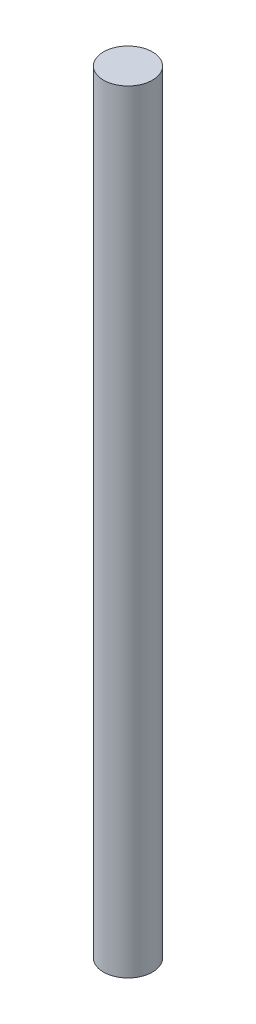
from build123d import *

# Parameters (mm, degrees)
SKETCH1_R           = 3.17
BOSS_EXTRUDE1_DEPTH = 100


with BuildPart() as part:
    # Sketch1 → Boss-Extrude1 (new body)
    with BuildSketch(Plane(origin=(0, 0, 0), x_dir=(1, 0, 0), z_dir=(0, 1, 0))):
        Circle(SKETCH1_R)
    extrude(amount=BOSS_EXTRUDE1_DEPTH)


solid = part.part
